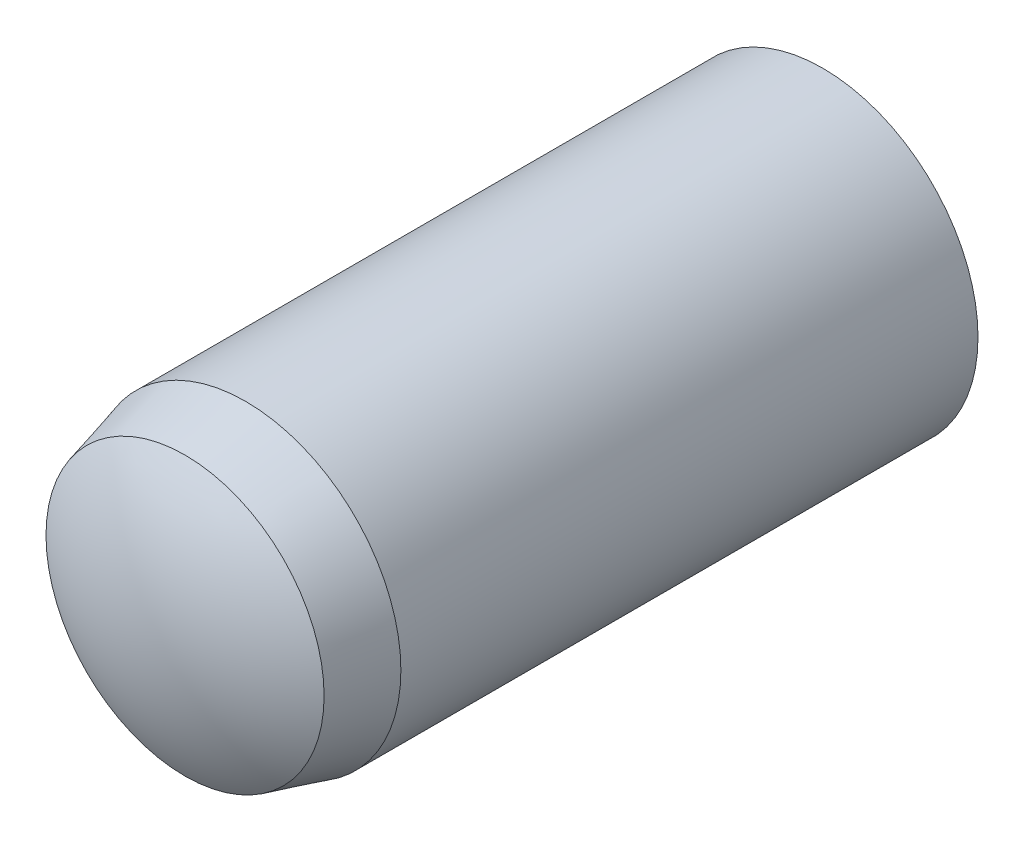
from build123d import *


with BuildPart() as part:
    # Sketch3 → Revolve1 (revolve)
    with BuildSketch(Plane(origin=(0, 0, 0), x_dir=(0, 0, -1), z_dir=(1, 0, 0))):
        with BuildLine():
            Line((-7, 0), (7, 0))
            ThreePointArc((7, 0), (6.770153254, 1.566045976), (6.1, 3))
            Line((6.1, 3), (-5.05, 3))
            Line((-5.05, 3), (-6.22, 2.686499445))
            ThreePointArc((-6.22, 2.686499445), (-6.801055079, 1.398720779), (-7, 0))
        make_face()
    revolve(axis=Axis((0, 0, 7), (0, 0, -1)))


solid = part.part
